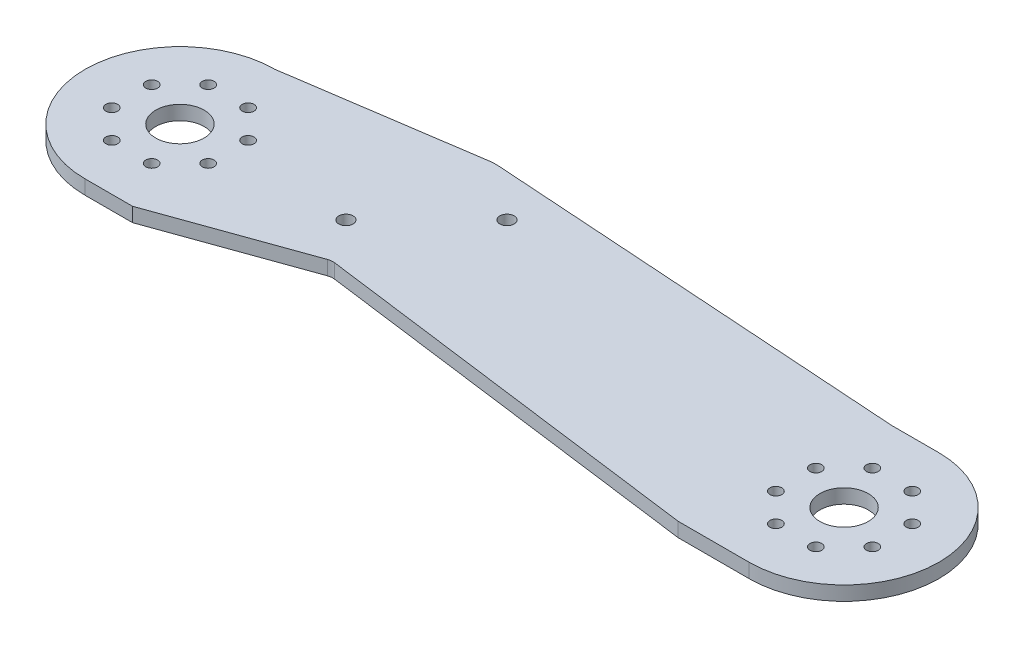
from build123d import *

# Parameters (mm, degrees)
SKETCH1_R           = 5.1
SKETCH1_R_2         = 1.25
SKETCH1_R_3         = 1.5
BOSS_EXTRUDE1_DEPTH = 3
FILLET1_R           = 3
CUT_EXTRUDE1_DEPTH  = 10
BOSS_EXTRUDE2_DEPTH = 3
CUT_EXTRUDE2_DEPTH  = 10
FILLET2_R           = 10


with BuildPart() as part:
    # Sketch1 → Boss-Extrude1 (new body)
    with BuildSketch(Plane(origin=(0, 0, 0), x_dir=(1, 0, 0), z_dir=(0, 1, 0))):
        with BuildLine():
            Line((70, 20), (-70, 20))
            ThreePointArc((-70, 20), (-90, 0), (-70, -20))
            Line((-70, -20), (-41, -20))
            Line((-41, -20), (-28.75, -7.75))
            Line((-28.75, -7.75), (-16.5, -20))
            Line((-16.5, -20), (70, -20))
            ThreePointArc((70, -20), (90, 0), (70, 20))
        make_face()
        with Locations(Location((70, 0, 0), (0, 0, 270))):
            Circle(SKETCH1_R, mode=Mode.SUBTRACT)
        with Locations(Location((59.837325142, 4.209517756, 0), (0, 0, 270))):
            Circle(SKETCH1_R_2, mode=Mode.SUBTRACT)
        with Locations(Location((65.790482244, 10.162674858, 0), (0, 0, 270))):
            Circle(SKETCH1_R_2, mode=Mode.SUBTRACT)
        with Locations(Location((74.209517756, 10.162674858, 0), (0, 0, 270))):
            Circle(SKETCH1_R_2, mode=Mode.SUBTRACT)
        with Locations(Location((80.162674858, 4.209517756, 0), (0, 0, 270))):
            Circle(SKETCH1_R_2, mode=Mode.SUBTRACT)
        with Locations(Location((80.162674858, -4.209517756, 0), (0, 0, 270))):
            Circle(SKETCH1_R_2, mode=Mode.SUBTRACT)
        with Locations(Location((74.209517756, -10.162674858, 0), (0, 0, 270))):
            Circle(SKETCH1_R_2, mode=Mode.SUBTRACT)
        with Locations(Location((65.790482244, -10.162674858, 0), (0, 0, 270))):
            Circle(SKETCH1_R_2, mode=Mode.SUBTRACT)
        with Locations(Location((59.837325142, -4.209517756, 0), (0, 0, 270))):
            Circle(SKETCH1_R_2, mode=Mode.SUBTRACT)
        with Locations(Location((-59.837325142, -4.209517756, 0), (0, 0, 90))):
            Circle(SKETCH1_R_2, mode=Mode.SUBTRACT)
        with Locations(Location((-65.790482244, -10.162674858, 0), (0, 0, 90))):
            Circle(SKETCH1_R_2, mode=Mode.SUBTRACT)
        with Locations(Location((-74.209517756, -10.162674858, 0), (0, 0, 90))):
            Circle(SKETCH1_R_2, mode=Mode.SUBTRACT)
        with Locations(Location((-80.162674858, -4.209517756, 0), (0, 0, 90))):
            Circle(SKETCH1_R_2, mode=Mode.SUBTRACT)
        with Locations(Location((-80.162674858, 4.209517756, 0), (0, 0, 90))):
            Circle(SKETCH1_R_2, mode=Mode.SUBTRACT)
        with Locations(Location((-74.209517756, 10.162674858, 0), (0, 0, 90))):
            Circle(SKETCH1_R_2, mode=Mode.SUBTRACT)
        with Locations(Location((-65.790482244, 10.162674858, 0), (0, 0, 90))):
            Circle(SKETCH1_R_2, mode=Mode.SUBTRACT)
        with Locations(Location((-59.837325142, 4.209517756, 0), (0, 0, 90))):
            Circle(SKETCH1_R_2, mode=Mode.SUBTRACT)
        with Locations(Location((-70, 0, 0), (0, 0, 90))):
            Circle(SKETCH1_R, mode=Mode.SUBTRACT)
        with Locations(Location((-35, 0, 0), (0, 0, 270))):
            Circle(SKETCH1_R_3, mode=Mode.SUBTRACT)
        with Locations(Location((-18.029437252, 16.970562748, 0), (0, 0, 270))):
            Circle(SKETCH1_R_3, mode=Mode.SUBTRACT)
    extrude(amount=BOSS_EXTRUDE1_DEPTH)

    # Fillet1
    fillet1_edges = [part.edges().sort_by_distance(p)[0] for p in [
        (-16.5, 1.5, 20),
        (-28.75, 1.5, 7.75),
        (-41, 1.5, 20),
    ]]
    fillet(fillet1_edges, radius=FILLET1_R)

    # Sketch2 → Cut-Extrude1 (cut)
    with BuildSketch(Plane.XZ):
        Polygon((-28.358163655, 9.01834005), (55, 20), (-28.358163655, 26.558419641), align=None)
    extrude(amount=-CUT_EXTRUDE1_DEPTH, mode=Mode.SUBTRACT)

    # Sketch3 → Boss-Extrude2 (add)
    with BuildSketch(Plane.XZ):
        Polygon((-70, -20), (-29.714195297, -26), (60, -20), align=None)
    extrude(amount=-BOSS_EXTRUDE2_DEPTH)

    # Sketch4 → Cut-Extrude2 (cut)
    with BuildSketch(Plane.XZ):
        Polygon((-29.761678485, 9.168369694), (-60, 20), (-60.52961588, 25.578691215), (-29.998372271, 24.401767037), align=None)
    extrude(amount=-CUT_EXTRUDE2_DEPTH, mode=Mode.SUBTRACT)

    # Fillet2
    # the kernel refuses this fillet: 10 mm, written as the material it adds along each edge
    with BuildSketch(Plane(origin=(60, 0, -20), x_dir=(-0.9977710708464071, 0, -0.06672997963445026), z_dir=(0, 1, 0))) as fillet2_piece_1:
        with BuildLine():
            CenterArc((FILLET2_R * 0.0334022154031, -FILLET2_R), FILLET2_R, 90, 3.826189391)
            Line((-FILLET2_R * 0.0333277642314, -FILLET2_R * 0.00222892915359), (0, 0))
            Line((0, 0), (FILLET2_R * 0.0334022154031, 0))
        make_face()
    extrude(amount=3)
    # the kernel refuses this fillet: 10 mm, written as the material it takes off along each edge
    with BuildSketch(Plane(origin=(-29.714195297, -2.693204599, -26), x_dir=(-0.9890902260552777, 0, 0.14731097963804135), z_dir=(0, 1, 0))) as fillet2_2_piece_1:
        with BuildLine():
            CenterArc((FILLET2_R * 0.107728183948, FILLET2_R), FILLET2_R, 257.702684713, 12.297315287)
            Line((-FILLET2_R * 0.105256420594, FILLET2_R * 0.0229444446563), (0, 0))
            Line((0, 0), (FILLET2_R * 0.107728183948, 0))
        make_face()
    extrude(amount=8.386409197, mode=Mode.SUBTRACT)


solid = part.part
